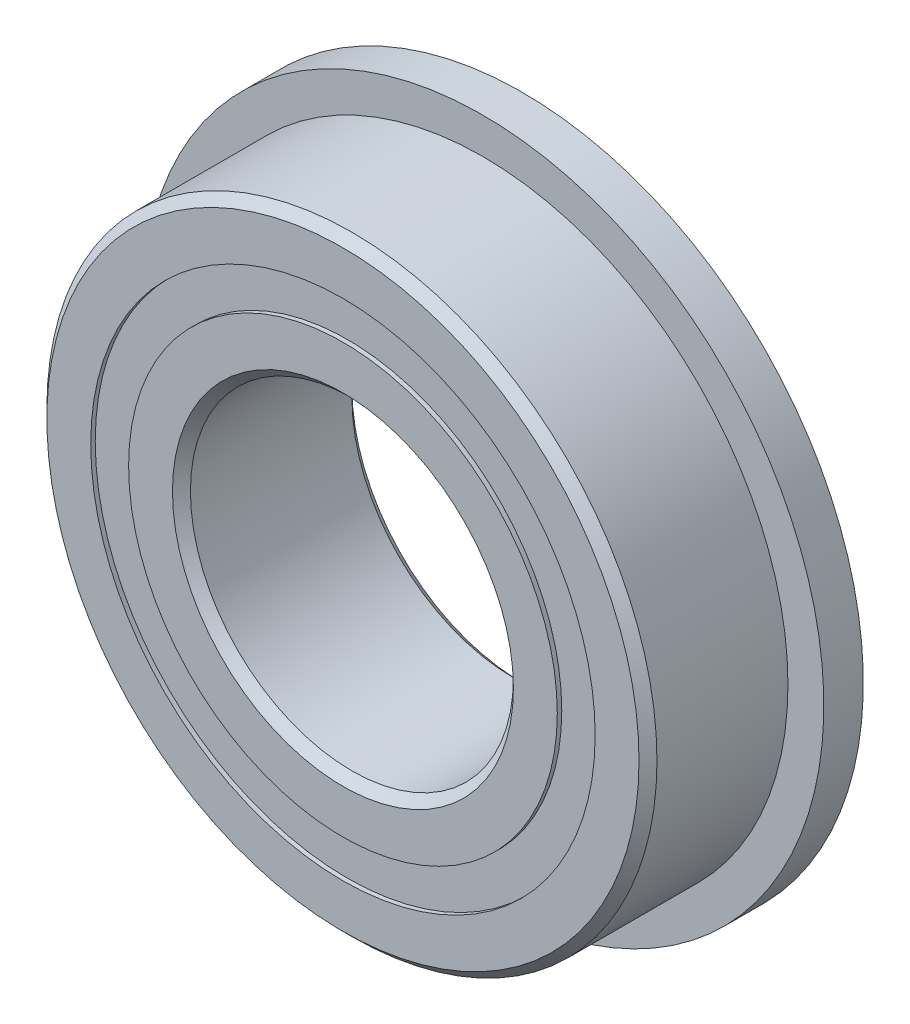
from build123d import *

# Parameters (mm, degrees)
CIRPATTERN1_COUNT = 12
SKETCH5_W         = 1.145042615
SKETCH5_H         = 1.054945054
SKETCH6_W         = 1.1
SKETCH6_H         = 2.472527473


with BuildPart() as part:
    # Sketch1 → Revolve1 (revolve)
    with BuildSketch(Plane(origin=(0, 0, 0), x_dir=(0, 0, -1), z_dir=(1, 0, 0))):
        with BuildLine():
            Line((2.25, 8.5), (-2.25, 8.5))
            Line((-2.25, 8.5), (-2.5, 8.25))
            Line((-2.5, 8.25), (-2.5, 7.027472527))
            Line((-2.5, 7.027472527), (-1.111111111, 7.027472527))
            ThreePointArc((-1.111111111, 7.027472527), (0, 7.729957385), (1.111111111, 7.027472527))
            Line((1.111111111, 7.027472527), (2.5, 7.027472527))
            Line((2.5, 7.027472527), (2.5, 8.25))
            Line((2.5, 8.25), (2.25, 8.5))
        make_face()
    revolve(axis=Axis((0, 0, 2.5), (0, 0, -1)))

    # Sketch6 → Revolve6 (revolve)
    with BuildSketch(Plane(origin=(0, 0, 0), x_dir=(0, 0, -1), z_dir=(1, 0, 0))):
        with Locations((1.95, 8.263736264)):
            Rectangle(SKETCH6_W, SKETCH6_H)
    revolve(axis=Axis((0, 0, -2.5), (0, 0, 1)))


with BuildPart() as body_2:
    # Sketch3 → Revolve3 (revolve)
    with BuildSketch(Plane(origin=(0, 0, 0), x_dir=(0, 0, -1), z_dir=(1, 0, 0))):
        with BuildLine():
            Line((-2.5, 5.972527473), (-1.111111111, 5.972527473))
            ThreePointArc((-1.111111111, 5.972527473), (0, 5.270042615), (1.111111111, 5.972527473))
            Line((1.111111111, 5.972527473), (2.5, 5.972527473))
            Line((2.5, 5.972527473), (2.5, 4.75))
            Line((2.5, 4.75), (2.25, 4.5))
            Line((2.25, 4.5), (-2.25, 4.5))
            Line((-2.25, 4.5), (-2.5, 4.75))
            Line((-2.5, 4.75), (-2.5, 5.972527473))
        make_face()
    revolve(axis=Axis((0, 0, 2.5), (0, 0, -1)))


with BuildPart() as body_3:
    # Sketch4 → Revolve4 (revolve)
    with BuildSketch(Plane(origin=(0, 0, 0), x_dir=(0, 0, -1), z_dir=(1, 0, 0))):
        with BuildLine():
            Line((-1.229957385, 6.5), (1.229957385, 6.5))
            ThreePointArc((1.229957385, 6.5), (0, 7.729957385), (-1.229957385, 6.5))
        make_face()
    revolve(axis=Axis((0, 6.5, 1.229957385), (0, 0, -1)))


with BuildPart() as cirpattern1_1:
    # CirPattern1: pattern copy
    add(body_3.part.rotate(Axis((0, 0, -2.5), (0, 0, 1)), 1 * 360 / CIRPATTERN1_COUNT))


with BuildPart() as cirpattern1_2:
    # CirPattern1: pattern copy
    add(body_3.part.rotate(Axis((0, 0, -2.5), (0, 0, 1)), 2 * 360 / CIRPATTERN1_COUNT))


with BuildPart() as cirpattern1_3:
    # CirPattern1: pattern copy
    add(body_3.part.rotate(Axis((0, 0, -2.5), (0, 0, 1)), 3 * 360 / CIRPATTERN1_COUNT))


with BuildPart() as cirpattern1_4:
    # CirPattern1: pattern copy
    add(body_3.part.rotate(Axis((0, 0, -2.5), (0, 0, 1)), 4 * 360 / CIRPATTERN1_COUNT))


with BuildPart() as cirpattern1_5:
    # CirPattern1: pattern copy
    add(body_3.part.rotate(Axis((0, 0, -2.5), (0, 0, 1)), 5 * 360 / CIRPATTERN1_COUNT))


with BuildPart() as cirpattern1_6:
    # CirPattern1: pattern copy
    add(body_3.part.rotate(Axis((0, 0, -2.5), (0, 0, 1)), 6 * 360 / CIRPATTERN1_COUNT))


with BuildPart() as cirpattern1_7:
    # CirPattern1: pattern copy
    add(body_3.part.rotate(Axis((0, 0, -2.5), (0, 0, 1)), 7 * 360 / CIRPATTERN1_COUNT))


with BuildPart() as cirpattern1_8:
    # CirPattern1: pattern copy
    add(body_3.part.rotate(Axis((0, 0, -2.5), (0, 0, 1)), 8 * 360 / CIRPATTERN1_COUNT))


with BuildPart() as cirpattern1_9:
    # CirPattern1: pattern copy
    add(body_3.part.rotate(Axis((0, 0, -2.5), (0, 0, 1)), 9 * 360 / CIRPATTERN1_COUNT))


with BuildPart() as cirpattern1_10:
    # CirPattern1: pattern copy
    add(body_3.part.rotate(Axis((0, 0, -2.5), (0, 0, 1)), 10 * 360 / CIRPATTERN1_COUNT))


with BuildPart() as cirpattern1_11:
    # CirPattern1: pattern copy
    add(body_3.part.rotate(Axis((0, 0, -2.5), (0, 0, 1)), 11 * 360 / CIRPATTERN1_COUNT))


with BuildPart() as body_15:
    # Sketch5 → Revolve5 (revolve)
    with BuildSketch(Plane(origin=(0, 0, 0), x_dir=(0, 0, -1), z_dir=(1, 0, 0))):
        with Locations((-1.802478693, 6.5)):
            Rectangle(SKETCH5_W, SKETCH5_H)
        with Locations((1.802478693, 6.5)):
            Rectangle(SKETCH5_W, SKETCH5_H)
    revolve(axis=Axis((0, 0, 2.5), (0, 0, -1)))


solid = Compound([part.part, body_2.part, body_3.part, cirpattern1_1.part, cirpattern1_2.part, cirpattern1_3.part, cirpattern1_4.part, cirpattern1_5.part, cirpattern1_6.part, cirpattern1_7.part, cirpattern1_8.part, cirpattern1_9.part, cirpattern1_10.part, cirpattern1_11.part, body_15.part])
